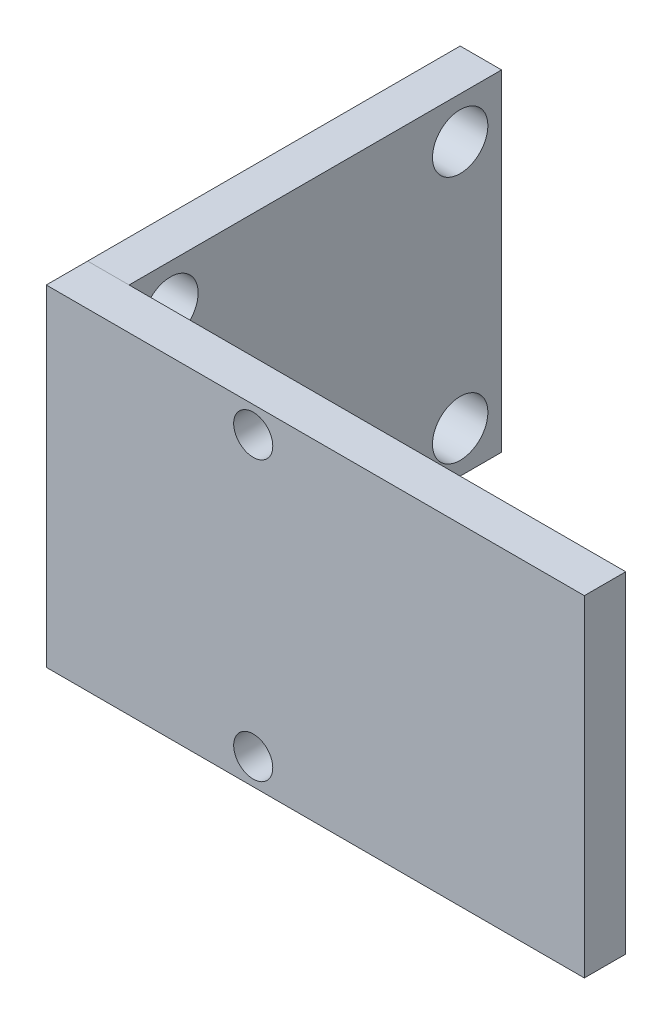
from build123d import *

# Parameters (mm, degrees)
SKETCH1_W                           = 22.86
SKETCH1_H                           = 20.32
SIDE_CONNECTING_TO_GRIP_DEPTH       = 2.54
M3_CLEARANCE_HOLE1_D                = 3.4
SIDE_CONNECTING_TO_SERVO_DEPTH      = 30.48
SIDE_CONNECTING_TO_SERVO_DEPTH_BACK = 2.54
SKETCH6_W                           = 2.54
SKETCH6_H                           = 20.32
SKETCH9_W                           = 1.2
SKETCH9_H                           = 25.4
CUTOUT_SERVO_HOLES_AT_2_COUNT       = 2
CUTOUT_SERVO_HOLES_AT_2_PITCH       = 17.1


with BuildPart() as part:
    # Sketch1 → side connecting to grip (new body)
    with BuildSketch(Plane(origin=(0, 0, 0), x_dir=(0, 0, -1), z_dir=(1, 0, 0))):
        with Locations((-31.87684378, 4.036305379)):
            Rectangle(SKETCH1_W, SKETCH1_H)
    extrude(amount=SIDE_CONNECTING_TO_GRIP_DEPTH)

    # M3 Clearance Hole1 (through all)
    with Locations(Plane(origin=(2.54, 0, 0), x_dir=(0, 0, -1), z_dir=(1, 0, 0))):
        with Locations((-40.76684378, 11.656305379), (-22.98684378, 11.656305379), (-22.98684378, -3.583694621), (-40.76684378, -3.583694621)):
            Hole(M3_CLEARANCE_HOLE1_D / 2)


with BuildPart() as body_2:
    # Sketch6 → side connecting to servo (new, two sides: drawn at the far end of the back side and taken through both)
    with BuildSketch(Plane(origin=(2.54, 0, 0), x_dir=(0, 0, -1), z_dir=(1, 0, 0)).offset(-SIDE_CONNECTING_TO_SERVO_DEPTH_BACK)):
        with Locations((-44.57684378, 4.036305379)):
            Rectangle(SKETCH6_W, SKETCH6_H)
    extrude(amount=SIDE_CONNECTING_TO_SERVO_DEPTH + SIDE_CONNECTING_TO_SERVO_DEPTH_BACK)

    # Sketch9 → cutout servo holes (revolve, cut)
    with BuildSketch(Plane(origin=(12.7, 12.586305379, 45.84684378), x_dir=(0, -1, 0), z_dir=(1, 0, 0))):
        with Locations((0.6, 12.7)):
            Rectangle(SKETCH9_W, SKETCH9_H)
    cutout_servo_holes = revolve(axis=Axis((12.7, 12.586305379, 52.19684378), (0, 0, -1)), mode=Mode.SUBTRACT)

    # cutout servo holes at 2: cutout servo holes ×2
    with Locations(*[(0, -i * CUTOUT_SERVO_HOLES_AT_2_PITCH, 0) for i in range(1, CUTOUT_SERVO_HOLES_AT_2_COUNT)]):
        add(cutout_servo_holes, mode=Mode.SUBTRACT)


solid = Compound([part.part, body_2.part])
